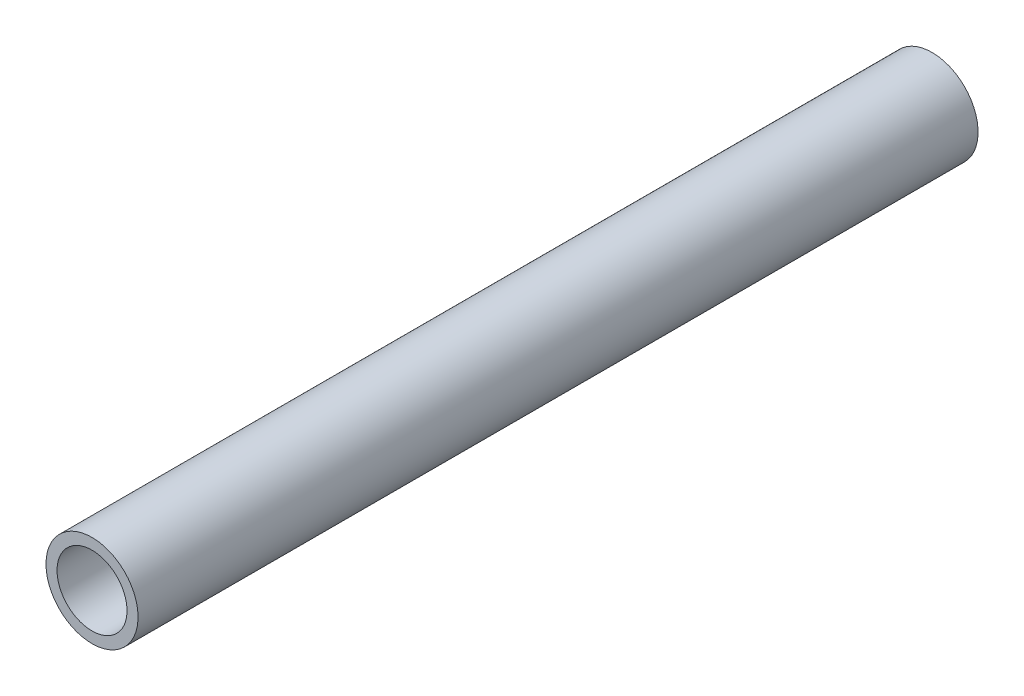
from build123d import *

# Parameters (mm, degrees)
SKETCH1_R           = 16.7005
SKETCH1_R_2         = 12.7
BOSS_EXTRUDE1_DEPTH = 304.8


with BuildPart() as part:
    # Sketch1 → Boss-Extrude1 (new body)
    with BuildSketch(Plane.XY):
        Circle(SKETCH1_R)
        Circle(SKETCH1_R_2, mode=Mode.SUBTRACT)
    extrude(amount=BOSS_EXTRUDE1_DEPTH)


solid = part.part
